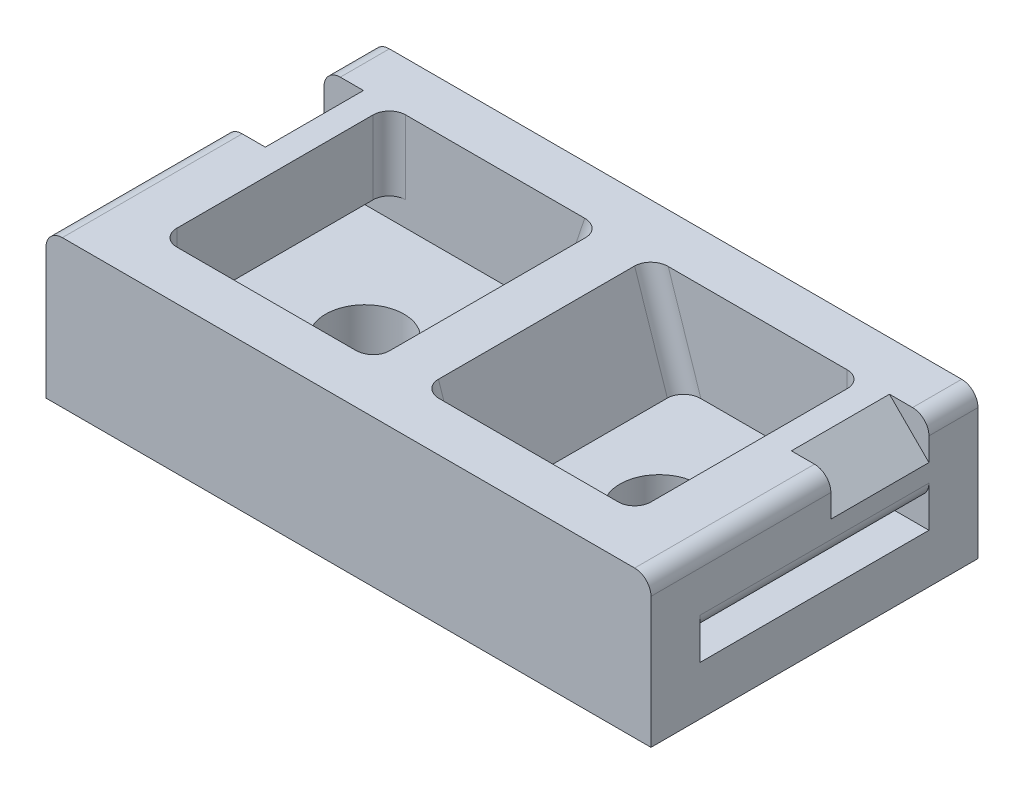
from build123d import *

# Parameters (mm, degrees)
SKETCH1_W           = 18.5
SKETCH1_H           = 10
SKETCH1_W_2         = 5.5
SKETCH1_H_2         = 7
BOSS_EXTRUDE1_DEPTH = 1.5
SKETCH1_3_W         = 18.5
SKETCH1_3_H         = 10
SKETCH1_3_W_2       = 5.5
SKETCH1_3_H_2       = 7
BOSS_EXTRUDE2_DEPTH = 4.5
CUT_EXTRUDE1_START  = -2
SKETCH2_W           = 7
SKETCH2_H           = 0.75
CUT_EXTRUDE1_DEPTH  = 2
CUT_EXTRUDE5_START  = -16.5
SKETCH2_2_W         = 7
SKETCH2_2_H         = 0.75
CUT_EXTRUDE5_DEPTH  = 2
SKETCH4_W           = 3
SKETCH4_H           = 2.690114405
CUT_EXTRUDE3_DEPTH  = 12.437329234
CHAMFER1_SIZE       = 1
CHAMFER1_SIZE_2     = 3
FILLET2_R           = 0.5


with BuildPart() as part:
    # Sketch1 → Boss-Extrude1 (new body)
    # profile 1 of 3: a face of its own
    with BuildSketch(Plane(origin=(0, 0, 0), x_dir=(1, 0, 0), z_dir=(0, 1, 0))):
        Rectangle(SKETCH1_W, SKETCH1_H)
        with Locations((4.5, 0)):
            Rectangle(SKETCH1_W_2, SKETCH1_H_2, mode=Mode.SUBTRACT)
        with Locations((-4.5, 0)):
            Rectangle(SKETCH1_W_2, SKETCH1_H_2, mode=Mode.SUBTRACT)
    # profile 2 of 3: a face of its own
    with BuildSketch(Plane(origin=(0, 0, 0), x_dir=(1, 0, 0), z_dir=(0, 1, 0))):
        with Locations((4.5, 0)):
            Rectangle(SKETCH1_W_2, SKETCH1_H_2)
    # profile 3 of 3: a face of its own
    with BuildSketch(Plane(origin=(0, 0, 0), x_dir=(1, 0, 0), z_dir=(0, 1, 0))):
        with Locations((-4.5, 0)):
            Rectangle(SKETCH1_W_2, SKETCH1_H_2)
    extrude(amount=BOSS_EXTRUDE1_DEPTH)

    # Sketch1<3> → Boss-Extrude2 (add)
    with BuildSketch(Plane(origin=(0, 0, 0), x_dir=(1, 0, 0), z_dir=(0, 1, 0))):
        Rectangle(SKETCH1_3_W, SKETCH1_3_H)
        with Locations((-4.5, 0)):
            Rectangle(SKETCH1_3_W_2, SKETCH1_3_H_2, mode=Mode.SUBTRACT)
        with Locations((4.5, 0)):
            Rectangle(SKETCH1_3_W_2, SKETCH1_3_H_2, mode=Mode.SUBTRACT)
    extrude(amount=BOSS_EXTRUDE2_DEPTH)

    # Sketch2 → Cut-Extrude1 (cut)
    with BuildSketch(Plane.ZY.offset(9.25).offset(CUT_EXTRUDE1_START)):
        with Locations((0, 1.875)):
            Rectangle(SKETCH2_W, SKETCH2_H)
    extrude(amount=CUT_EXTRUDE1_DEPTH, mode=Mode.SUBTRACT)

    # Sketch2<2> → Cut-Extrude5 (cut)
    with BuildSketch(Plane.ZY.offset(9.25).offset(CUT_EXTRUDE5_START)):
        with Locations((0, 1.875)):
            Rectangle(SKETCH2_2_W, SKETCH2_2_H)
    extrude(amount=-CUT_EXTRUDE5_DEPTH, mode=Mode.SUBTRACT)

    # Sketch4 → Cut-Extrude3 (cut, symmetric)
    with BuildSketch(Plane(origin=(0, 0, 0), x_dir=(0, 0, 1), z_dir=(0.7071067811865488, 0.7071067811865464, 0))):
        with Locations((-2, -10.214222054)):
            Rectangle(SKETCH4_W, SKETCH4_H)
    cut_extrude3 = extrude(amount=CUT_EXTRUDE3_DEPTH, both=True, mode=Mode.SUBTRACT)

    # Sketch5 → M2 Clearance Hole1 (revolve, cut)
    with BuildSketch(Plane(origin=(-4.5, 1.5, 0), x_dir=(0, 0, 1), z_dir=(1, 0, 0))):
        Polygon((0, 0), (0, 2.321032743), (1.2, 1.6), (1.2, 0), align=None)
    m2_clearance_hole1 = revolve(axis=Axis((-4.5, 7.85, 0), (0, -1, 0)), mode=Mode.SUBTRACT)

    # Mirror4: Cut-Extrude3, M2 Clearance Hole1 across plane
    add(cut_extrude3.mirror(Plane(origin=(0, 0, 0), x_dir=(0, 0, 1), z_dir=(1, 0, 0))), mode=Mode.SUBTRACT)
    add(m2_clearance_hole1.mirror(Plane(origin=(0, 0, 0), x_dir=(0, 0, 1), z_dir=(1, 0, 0))), mode=Mode.SUBTRACT)

    # Chamfer1
    # the kernel refuses this chamfer: 3, 1 mm, written as the material it takes off along each edge
    with BuildSketch(Plane(origin=(-1.75, 4.5, -3.5), x_dir=(0.9940388851139268, 0.10902612017980688, 0), z_dir=(0, 0, 1)), Plane(origin=(1.75, 4.5, 3.5), x_dir=(-0.9940388851139268, 0.10902612017980688, 0), z_dir=(0, 0, -1))) as chamfer1_piece_1:
        Polygon((CHAMFER1_SIZE * 0.994038885114, -CHAMFER1_SIZE * 0.10902612018), (-CHAMFER1_SIZE_2 * 0.10902612018, -CHAMFER1_SIZE_2 * 0.994038885114), (0, 0), align=None)
    extrude(amount=7, mode=Mode.SUBTRACT)

    # Fillet2
    fillet2_edges = [part.edges().sort_by_distance(p)[0] for p in [
        (9.25, 4.5, -4.25),
        (1.25, 3, 3.5),
        (1.25, 3, -3.5),
        (-1.25, 3, -3.5),
        (-1.25, 3, 3.5),
        (-9.25, 4.5, -4.25),
        (9.25, 4.5, 2.25),
        (-7.25, 3.375, 3.5),
        (-7.25, 3.375, -3.5),
        (7.25, 3.375, 3.5),
        (7.25, 3.375, -3.5),
        (-9.25, 2.25, 0),
        (9.25, 2.25, 0),
        (-9.25, 4.5, 2.25),
    ]]
    fillet(fillet2_edges, radius=FILLET2_R)


solid = part.part
